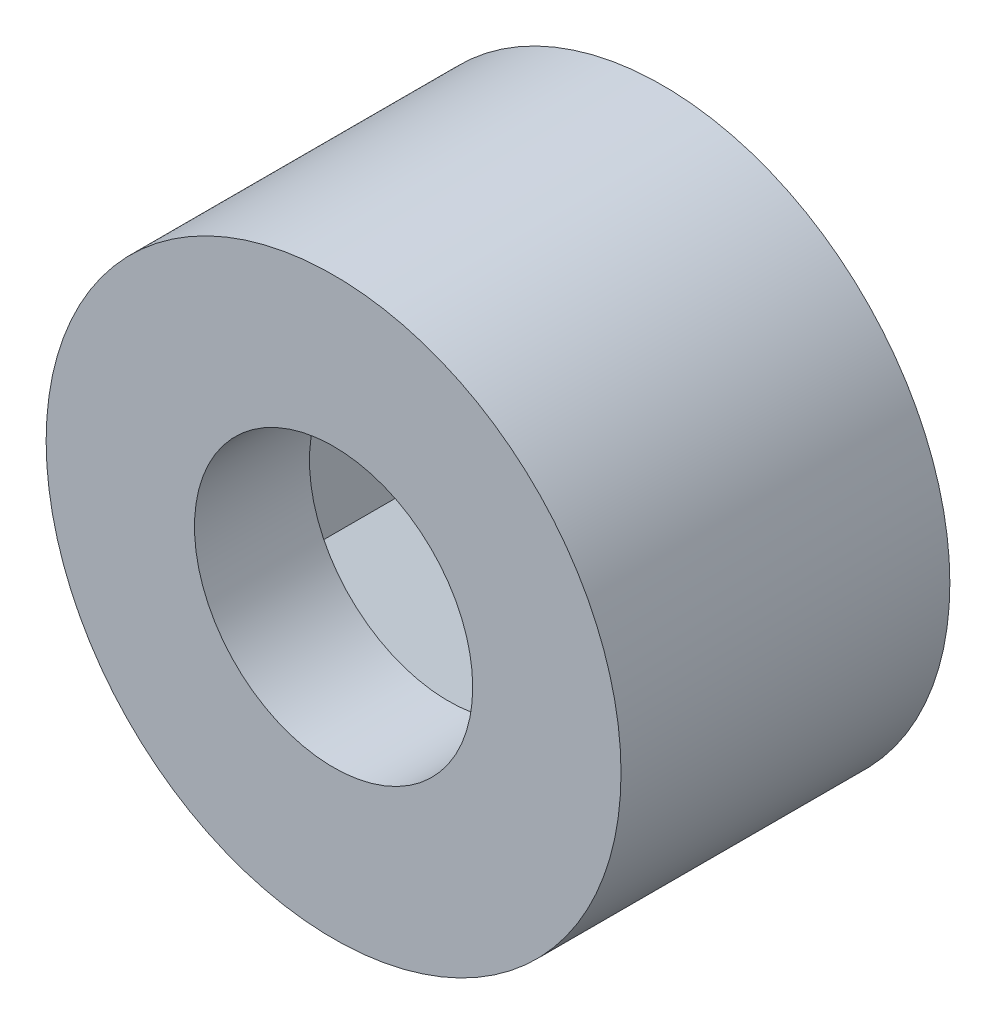
from build123d import *

# Parameters (mm, degrees)
SKETCH1_R           = 12.5
BOSS_EXTRUDE1_DEPTH = 6.3
SKETCH2_R           = 12.5
SKETCH2_R_2         = 6.05
BOSS_EXTRUDE2_DEPTH = 5
BOSS_EXTRUDE3_START = 3
SKETCH3_R           = 12.5
SKETCH3_R_2         = 4
BOSS_EXTRUDE3_DEPTH = 3
BOSS_EXTRUDE4_START = -0.6
SKETCH4_R           = 4
BOSS_EXTRUDE4_DEPTH = 0.6


with BuildPart() as part:
    # Sketch1 → Boss-Extrude1 (new body)
    with BuildSketch(Plane.XY):
        Circle(SKETCH1_R)
        Polygon((0, -7.505553499), (6.5, -3.75277675), (6.5, 3.75277675), (0, 7.505553499), (-6.5, 3.75277675), (-6.5, -3.75277675), align=None, mode=Mode.SUBTRACT)
    extrude(amount=BOSS_EXTRUDE1_DEPTH)

    # Sketch2 → Boss-Extrude2 (add)
    with BuildSketch(Plane.XY.offset(6.3)):
        Circle(SKETCH2_R)
        Circle(SKETCH2_R_2, mode=Mode.SUBTRACT)
    extrude(amount=BOSS_EXTRUDE2_DEPTH)

    # Sketch3 → Boss-Extrude3 (add)
    with BuildSketch(Plane(origin=(0, 0, 0), x_dir=(-1, 0, 0), z_dir=(0, 0, -1)).offset(BOSS_EXTRUDE3_START)):
        Circle(SKETCH3_R)
        Circle(SKETCH3_R_2, mode=Mode.SUBTRACT)
    extrude(amount=-BOSS_EXTRUDE3_DEPTH)

    # Sketch4 → Boss-Extrude4 (add)
    with BuildSketch(Plane.XY.offset(BOSS_EXTRUDE4_START)):
        Circle(SKETCH4_R)
    extrude(amount=BOSS_EXTRUDE4_DEPTH)


solid = part.part
